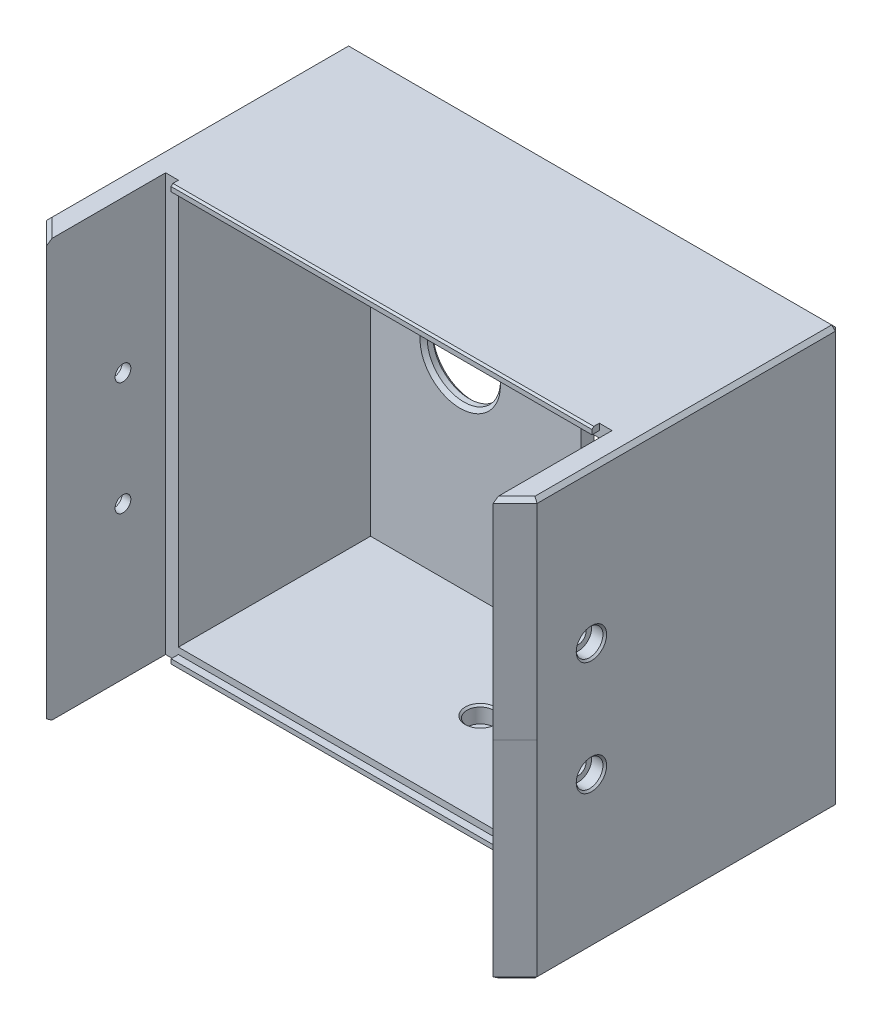
from build123d import *

# Parameters (mm, degrees)
SKETCH1_W                       = 134
SKETCH1_H                       = 57
BOSS_EXTRUDE1_DEPTH             = 250
SKETCH2_W                       = 115
SKETCH2_H                       = 53.5
CUT_EXTRUDE1_DEPTH              = 246.5
SKETCH3_W                       = 115
SKETCH3_H                       = 194
CUT_EXTRUDE2_DEPTH              = 3.5
SKETCH4_W                       = 6
SKETCH4_H                       = 120
CUT_EXTRUDE3_DEPTH              = 290.318163965
CHAMFER1_SIZE                   = 6
SKETCH5_R                       = 2.15
CUT_EXTRUDE4_DEPTH              = 134
SKETCH6_W                       = 25
SKETCH6_H                       = 4.5
BOSS_EXTRUDE2_DEPTH             = 115
SKETCH7_R                       = 3.65
CUT_EXTRUDE5_DEPTH              = 3.6
CUT_EXTRUDE6_START              = -3.6
SKETCH8_R                       = 3.65
CUT_EXTRUDE6_DEPTH              = 3.6
CHAMFER1_OF_MIRROR1_SIZE        = 6
SKETCH9_R                       = 1.65
CUT_EXTRUDE7_DEPTH              = 25
CHAMFER3_SIZE                   = 0.5
SKETCH11_R                      = 1.65
CUT_EXTRUDE9_DEPTH              = 3.5
CUT_EXTRUDE10_DEPTH             = 306.69919856
BOSS_EXTRUDE4_DEPTH             = 10
CHAMFER4_SIZE                   = 10
BOSS_EXTRUDE5_REACH             = 159.166
BOSS_EXTRUDE5_DIRECTION_2_DEPTH = 3.5
SKETCH17_R                      = 10
CUT_EXTRUDE13_DEPTH             = 3.5
SKETCH15_R                      = 2.15
CUT_EXTRUDE11_DEPTH             = 13.5
SKETCH16_R                      = 3.65
CUT_EXTRUDE12_DEPTH             = 4.5
CHAMFER6_SIZE                   = 1
CHAMFER5_SIZE                   = 0.5
SKETCH19_W                      = 33
SKETCH19_H                      = 3.5
CUT_EXTRUDE14_DEPTH             = 3.5
CHAMFER8_SIZE                   = 3.5
SKETCH20_W                      = 122
SKETCH20_H                      = 1.75
BOSS_EXTRUDE6_DEPTH             = 2
SKETCH21_W                      = 3.5
SKETCH21_H                      = 2
CUT_EXTRUDE15_DEPTH             = 114
CHAMFER9_SIZE                   = 0.5


# Some blends are built 0.0001 mm under size
with BuildPart() as part:
    # Sketch1 → Boss-Extrude1 (new body)
    with BuildSketch(Plane.XY):
        with Locations((67, 28.5)):
            Rectangle(SKETCH1_W, SKETCH1_H)
    boss_extrude1 = extrude(amount=BOSS_EXTRUDE1_DEPTH)

    # Sketch2 → Cut-Extrude1 (cut)
    with BuildSketch(Plane.XY.offset(250)):
        with Locations((67, 26.75)):
            Rectangle(SKETCH2_W, SKETCH2_H)
    cut_extrude1 = extrude(amount=-CUT_EXTRUDE1_DEPTH, mode=Mode.SUBTRACT)

    # Sketch3 → Cut-Extrude2 (cut)
    with BuildSketch(Plane(origin=(0, 57, 0), x_dir=(1, 0, 0), z_dir=(0, 1, 0))):
        with Locations((67, -153)):
            Rectangle(SKETCH3_W, SKETCH3_H)
    cut_extrude2 = extrude(amount=-CUT_EXTRUDE2_DEPTH, mode=Mode.SUBTRACT)

    # Sketch4 → Cut-Extrude3 (cut, through all)
    with BuildSketch(Plane.XZ):
        with Locations((3, 142.5)):
            Rectangle(SKETCH4_W, SKETCH4_H)
        with Locations((131, 142.5)):
            Rectangle(SKETCH4_W, SKETCH4_H)
    cut_extrude3 = extrude(amount=-CUT_EXTRUDE3_DEPTH, mode=Mode.SUBTRACT)

    # Chamfer1
    chamfer1_edges = [part.edges().sort_by_distance(p)[0] for p in [
        (6, 28.5, 202.5),
        (6, 28.5, 82.5),
        (128, 28.5, 82.5),
        (128, 28.5, 202.5),
    ]]
    chamfer(chamfer1_edges, length=CHAMFER1_SIZE - 0.0001)  # a hair under: the kernel refuses the full size

    # Sketch5 → Cut-Extrude4 (cut)
    with BuildSketch(Plane(origin=(134, 0, 0), x_dir=(0, 0, -1), z_dir=(1, 0, 0))):
        with Locations((-217.65, 15.5)):
            Circle(SKETCH5_R)
        with Locations((-67.65, 15.5)):
            Circle(SKETCH5_R)
    cut_extrude4 = extrude(amount=-CUT_EXTRUDE4_DEPTH, mode=Mode.SUBTRACT)

    # Sketch6 → Boss-Extrude2 (add)
    with BuildSketch(Plane(origin=(9.5, 0, 0), x_dir=(0, 0, -1), z_dir=(1, 0, 0))):
        with Locations((-237.5, 2.25)):
            Rectangle(SKETCH6_W, SKETCH6_H)
    boss_extrude2 = extrude(amount=BOSS_EXTRUDE2_DEPTH)

    # Sketch7 → Cut-Extrude5 (cut)
    with BuildSketch(Plane(origin=(134, 0, 0), x_dir=(0, 0, -1), z_dir=(1, 0, 0))):
        with Locations((-217.65, 15.5)):
            Circle(SKETCH7_R)
        with Locations((-67.65, 15.5)):
            Circle(SKETCH7_R)
    cut_extrude5 = extrude(amount=-CUT_EXTRUDE5_DEPTH, mode=Mode.SUBTRACT)

    # Sketch8 → Cut-Extrude6 (cut)
    with BuildSketch(Plane.ZY.offset(CUT_EXTRUDE6_START)):
        with Locations(Location((217.65, 15.5, 0), (0, 0, 180))):
            Circle(SKETCH8_R)
        with Locations(Location((67.65, 15.5, 0), (0, 0, 180))):
            Circle(SKETCH8_R)
    cut_extrude6 = extrude(amount=CUT_EXTRUDE6_DEPTH, mode=Mode.SUBTRACT)


with BuildPart() as mirror1_1:
    # Mirror1: Boss-Extrude1 across plane
    add(boss_extrude1.mirror(Plane.ZX))

    # Mirror1 2: Cut-Extrude1, Cut-Extrude2, Cut-Extrude3, Cut-Extrude4 across plane
    add(cut_extrude1.mirror(Plane.ZX), mode=Mode.SUBTRACT)
    add(cut_extrude2.mirror(Plane.ZX), mode=Mode.SUBTRACT)
    add(cut_extrude3.mirror(Plane.ZX), mode=Mode.SUBTRACT)
    add(cut_extrude4.mirror(Plane.ZX), mode=Mode.SUBTRACT)

    # Mirror1 4: Cut-Extrude5, Cut-Extrude6 across plane
    add(cut_extrude5.mirror(Plane.ZX), mode=Mode.SUBTRACT)
    add(cut_extrude6.mirror(Plane.ZX), mode=Mode.SUBTRACT)

    # Chamfer1 of Mirror1
    chamfer1_of_mirror1_edges = [mirror1_1.edges().sort_by_distance(p)[0] for p in [
        (6, -28.5, 202.5),
        (6, -28.5, 82.5),
        (128, -28.5, 82.5),
        (128, -28.5, 202.5),
    ]]
    chamfer(chamfer1_of_mirror1_edges, length=CHAMFER1_OF_MIRROR1_SIZE - 0.0001)  # a hair under: the kernel refuses the full size


with BuildPart() as mirror1_3_1:
    # Mirror1 3: Boss-Extrude2 across plane
    add(boss_extrude2.mirror(Plane.ZX))


with BuildPart() as part_1:
    add(part.part)

    # Mirror1 united with what the copies touc: union Mirror1_1, Mirror1 3_1
    add(mirror1_1.part)
    add(mirror1_3_1.part)

    # Sketch9 → Cut-Extrude7 (cut)
    with BuildSketch(Plane.XY.offset(250)):
        with Locations((25, 0)):
            Circle(SKETCH9_R)
        with Locations((109, 0)):
            Circle(SKETCH9_R)
    extrude(amount=-CUT_EXTRUDE7_DEPTH, mode=Mode.SUBTRACT)

    # Chamfer2
    # the kernel refuses this chamfer: 1 mm, written as the material it takes off along each edge
    with BuildSketch(Plane(origin=(133.333333333, -56.333333333, 0.666666667), x_dir=(-0.7071067811865475, -0.7071067811865475, 0), z_dir=(0.5773502691896257, -0.5773502691896258, -0.5773502691896258))) as chamfer2_piece_1:
        Polygon((-0.707106781, -0.40824829), (0.707106781, -0.40824829), (0, 0.816496581), align=None)
    extrude(amount=1.270170592, mode=Mode.SUBTRACT)
    with BuildSketch(Plane(origin=(0.666666667, -56.333333333, 0.666666667), x_dir=(0.7071067811865475, -0.7071067811865475, 0), z_dir=(-0.5773502691896258, -0.5773502691896258, -0.5773502691896258)), Plane(origin=(133.333333333, 56.333333333, 0.666666667), x_dir=(-0.7071067811865475, 0.7071067811865475, 0), z_dir=(0.5773502691896257, 0.5773502691896258, -0.5773502691896258)), Plane(origin=(0.666666667, 56.333333333, 0.666666667), x_dir=(-0.7071067811865475, -0.7071067811865475, 0), z_dir=(-0.5773502691896257, 0.5773502691896258, -0.5773502691896257))) as chamfer2_piece_2:
        Polygon((-0.707106781, 0.40824829), (0.707106781, 0.40824829), (0, -0.816496581), align=None)
    extrude(amount=1.270170592, mode=Mode.SUBTRACT)
    with BuildSketch(Plane(origin=(0, -57, 199.928317012), x_dir=(0.9996219169112968, -0.02749587661058908, 0), z_dir=(0, 0, 1)), Plane(origin=(134, 57, 199.928317012), x_dir=(-0.9996219169112968, 0.027495876610589196, 0), z_dir=(0, 0, 1))) as chamfer2_piece_3:
        with BuildLine():
            Line((1.028673195, 0), (-0.056547155, 1.027117794))
            Line((-0.056547155, 1.027117794), (-0.076539593, 1.026567876))
            ThreePointArc((-0.076539593, 1.026567876), (-0.034129227, 0.51339783), (-0.019992438, -0.000549918))
            Line((-0.019992438, -0.000549918), (0.000549918, -0.019992438))
            ThreePointArc((0.000549918, -0.019992438), (0.514497665, -0.00585565), (1.029223113, -0.019992438))
            Line((1.029223113, -0.019992438), (1.028673195, 0))
        make_face()
    extrude(amount=52.643365976, mode=Mode.SUBTRACT)
    with BuildSketch(Plane(origin=(134, -57, 199.928317012), x_dir=(-0.9996219169112968, -0.027495876610589196, 0), z_dir=(0, 0, 1)), Plane(origin=(0, 57, 199.928317012), x_dir=(0.9996219169112968, 0.02749587661058908, 0), z_dir=(0, 0, 1))) as chamfer2_piece_4:
        with BuildLine():
            Line((1.028673195, 0), (-0.056547155, -1.027117794))
            Line((-0.056547155, -1.027117794), (-0.076539593, -1.026567876))
            ThreePointArc((-0.076539593, -1.026567876), (-0.034129227, -0.51339783), (-0.019992438, 0.000549918))
            Line((-0.019992438, 0.000549918), (0.000549918, 0.019992438))
            ThreePointArc((0.000549918, 0.019992438), (0.514497665, 0.00585565), (1.029223113, 0.019992438))
            Line((1.029223113, 0.019992438), (1.028673195, 0))
        make_face()
    extrude(amount=52.643365976, mode=Mode.SUBTRACT)
    with BuildSketch(Plane(origin=(136.571682988, -57, 0), x_dir=(0, -0.02749587661058908, 0.9996219169112968), z_dir=(-1, 0, 0))) as chamfer2_piece_5:
        with BuildLine():
            Line((1.028673195, 0), (-0.056547155, 1.027117794))
            Line((-0.056547155, 1.027117794), (-0.076539593, 1.026567876))
            ThreePointArc((-0.076539593, 1.026567876), (-0.034129227, 0.51339783), (-0.019992438, -0.000549918))
            Line((-0.019992438, -0.000549918), (0.000549918, -0.019992438))
            ThreePointArc((0.000549918, -0.019992438), (0.514497665, -0.00585565), (1.029223113, -0.019992438))
            Line((1.029223113, -0.019992438), (1.028673195, 0))
        make_face()
    extrude(amount=139.143365976, mode=Mode.SUBTRACT)
    with BuildSketch(Plane(origin=(134, -57, -2.571682988), x_dir=(0.027495876610582105, 0.999621916911297, 0), z_dir=(0, 0, 1)), Plane(origin=(0, -57, -2.571682988), x_dir=(0.9996219169112968, -0.02749587661058908, 0), z_dir=(0, 0, 1))) as chamfer2_piece_6:
        with BuildLine():
            Line((1.028673195, 0), (-0.056547155, 1.027117794))
            Line((-0.056547155, 1.027117794), (-0.076539593, 1.026567876))
            ThreePointArc((-0.076539593, 1.026567876), (-0.034129227, 0.51339783), (-0.019992438, -0.000549918))
            Line((-0.019992438, -0.000549918), (0.000549918, -0.019992438))
            ThreePointArc((0.000549918, -0.019992438), (0.514497665, -0.00585565), (1.029223113, -0.019992438))
            Line((1.029223113, -0.019992438), (1.028673195, 0))
        make_face()
    extrude(amount=87.643365976, mode=Mode.SUBTRACT)
    with BuildSketch(Plane(origin=(6, -57, 85.928217012), x_dir=(0.9996219169112968, -0.027495876610589075, 0), z_dir=(0, 0, 1))) as chamfer2_piece_7_section:
        with BuildLine():
            Line((1.028673195, 0), (-0.056547155, 1.027117794))
            Line((-0.056547155, 1.027117794), (-0.076539593, 1.026567876))
            ThreePointArc((-0.076539593, 1.026567876), (-0.034129227, 0.51339783), (-0.019992438, -0.000549918))
            Line((-0.019992438, -0.000549918), (0.000549918, -0.019992438))
            ThreePointArc((0.000549918, -0.019992438), (0.514497665, -0.00585565), (1.029223113, -0.019992438))
            Line((1.029223113, -0.019992438), (1.028673195, 0))
        make_face()
    chamfer2_piece_7 = extrude(amount=113.143565976, mode=Mode.PRIVATE)
    chamfer2_piece_7 = split(chamfer2_piece_7, bisect_by=Plane(origin=(33.164355215, -56.669573831, 115.664255215), z_dir=(-0.7071067811865475, 0, 0.7071067811865477)), keep=Keep.TOP, mode=Mode.PRIVATE)
    chamfer2_piece_7 = split(chamfer2_piece_7, bisect_by=Plane(origin=(33.164355215, -56.669573831, 169.335744785), z_dir=(-0.7071067811865472, 0, -0.7071067811865478)), keep=Keep.TOP, mode=Mode.PRIVATE)
    add(chamfer2_piece_7, mode=Mode.SUBTRACT)
    with BuildSketch(Plane(origin=(128, -57, 85.928217012), x_dir=(0.027495876610582105, 0.999621916911297, 0), z_dir=(0, 0, 1))) as chamfer2_piece_8_section:
        with BuildLine():
            Line((1.028673195, 0), (-0.056547155, 1.027117794))
            Line((-0.056547155, 1.027117794), (-0.076539593, 1.026567876))
            ThreePointArc((-0.076539593, 1.026567876), (-0.034129227, 0.51339783), (-0.019992438, -0.000549918))
            Line((-0.019992438, -0.000549918), (0.000549918, -0.019992438))
            ThreePointArc((0.000549918, -0.019992438), (0.514497665, -0.00585565), (1.029223113, -0.019992438))
            Line((1.029223113, -0.019992438), (1.028673195, 0))
        make_face()
    chamfer2_piece_8 = extrude(amount=113.143565976, mode=Mode.PRIVATE)
    chamfer2_piece_8 = split(chamfer2_piece_8, bisect_by=Plane(origin=(100.835644785, -56.669573831, 115.664255215), z_dir=(0.7071067811865476, 0, 0.7071067811865476)), keep=Keep.TOP, mode=Mode.PRIVATE)
    chamfer2_piece_8 = split(chamfer2_piece_8, bisect_by=Plane(origin=(100.835644785, -56.669573831, 169.335744785), z_dir=(0.7071067811865476, 0, -0.7071067811865476)), keep=Keep.TOP, mode=Mode.PRIVATE)
    add(chamfer2_piece_8, mode=Mode.SUBTRACT)
    with BuildSketch(Plane(origin=(-1.81835448, -57, 204.31845448), x_dir=(0.7068394360706731, -0.027495876610588672, 0.7068394360706738), z_dir=(0.7071067811865479, 0, -0.7071067811865474))) as chamfer2_piece_9_section:
        with BuildLine():
            Line((1.028673195, 0), (-0.056547155, -1.027117794))
            Line((-0.056547155, -1.027117794), (-0.076539593, -1.026567876))
            ThreePointArc((-0.076539593, -1.026567876), (-0.034129227, -0.51339783), (-0.019992438, 0.000549918))
            Line((-0.019992438, 0.000549918), (0.000549918, 0.019992438))
            ThreePointArc((0.000549918, 0.019992438), (0.514497665, 0.00585565), (1.029223113, 0.019992438))
            Line((1.029223113, 0.019992438), (1.028673195, 0))
        make_face()
    chamfer2_piece_9 = extrude(amount=13.628505929, mode=Mode.PRIVATE)
    chamfer2_piece_9 = split(chamfer2_piece_9, bisect_by=Plane(origin=(6, -56.681906875, 203.533564865), z_dir=(-1, 0, 0)), keep=Keep.TOP, mode=Mode.PRIVATE)
    add(chamfer2_piece_9, mode=Mode.SUBTRACT)
    with BuildSketch(Plane(origin=(7.81845448, -57, 90.31835448), x_dir=(0.7068394360706733, -0.027495876610588946, -0.7068394360706736), z_dir=(-0.7071067811865477, 0, -0.7071067811865475))) as chamfer2_piece_10_section:
        with BuildLine():
            Line((1.028673195, 0), (-0.056547155, -1.027117794))
            Line((-0.056547155, -1.027117794), (-0.076539593, -1.026567876))
            ThreePointArc((-0.076539593, -1.026567876), (-0.034129227, -0.51339783), (-0.019992438, 0.000549918))
            Line((-0.019992438, 0.000549918), (0.000549918, 0.019992438))
            ThreePointArc((0.000549918, 0.019992438), (0.514497665, 0.00585565), (1.029223113, 0.019992438))
            Line((1.029223113, 0.019992438), (1.028673195, 0))
        make_face()
    chamfer2_piece_10 = extrude(amount=13.628505929, mode=Mode.PRIVATE)
    chamfer2_piece_10 = split(chamfer2_piece_10, bisect_by=Plane(origin=(6, -56.661529994, 85.278226705), z_dir=(-1, 0, 0)), keep=Keep.TOP, mode=Mode.PRIVATE)
    add(chamfer2_piece_10, mode=Mode.SUBTRACT)
    with BuildSketch(Plane(origin=(135.81835448, -57, 80.68154552), x_dir=(0.01944252080601719, 0.9996219169112965, 0.01944252080601719), z_dir=(-0.7071067811865476, 0, 0.7071067811865476))) as chamfer2_piece_11_section:
        with BuildLine():
            Line((1.028673195, 0), (-0.056547155, 1.027117794))
            Line((-0.056547155, 1.027117794), (-0.076539593, 1.026567876))
            ThreePointArc((-0.076539593, 1.026567876), (-0.034129227, 0.51339783), (-0.019992438, -0.000549918))
            Line((-0.019992438, -0.000549918), (0.000549918, -0.019992438))
            ThreePointArc((0.000549918, -0.019992438), (0.514497665, -0.00585565), (1.029223113, -0.019992438))
            Line((1.029223113, -0.019992438), (1.028673195, 0))
        make_face()
    chamfer2_piece_11 = extrude(amount=13.628505929, mode=Mode.PRIVATE)
    chamfer2_piece_11 = split(chamfer2_piece_11, bisect_by=Plane(origin=(128, -56.681906875, 81.466435135), z_dir=(1, 0, 0)), keep=Keep.TOP, mode=Mode.PRIVATE)
    add(chamfer2_piece_11, mode=Mode.SUBTRACT)
    with BuildSketch(Plane(origin=(126.18154552, -57, 194.68164552), x_dir=(-0.7068394360706735, -0.027495876610588745, 0.7068394360706735), z_dir=(0.7071067811865476, 0, 0.7071067811865476))) as chamfer2_piece_12_section:
        with BuildLine():
            Line((1.028673195, 0), (-0.056547155, -1.027117794))
            Line((-0.056547155, -1.027117794), (-0.076539593, -1.026567876))
            ThreePointArc((-0.076539593, -1.026567876), (-0.034129227, -0.51339783), (-0.019992438, 0.000549918))
            Line((-0.019992438, 0.000549918), (0.000549918, 0.019992438))
            ThreePointArc((0.000549918, 0.019992438), (0.514497665, 0.00585565), (1.029223113, 0.019992438))
            Line((1.029223113, 0.019992438), (1.028673195, 0))
        make_face()
    chamfer2_piece_12 = extrude(amount=13.628505929, mode=Mode.PRIVATE)
    chamfer2_piece_12 = split(chamfer2_piece_12, bisect_by=Plane(origin=(128, -56.661529994, 199.721773295), z_dir=(1, 0, 0)), keep=Keep.TOP, mode=Mode.PRIVATE)
    add(chamfer2_piece_12, mode=Mode.SUBTRACT)
    with BuildSketch(Plane(origin=(134, 57, -2.571682988), x_dir=(0.027495876610582105, -0.999621916911297, 0), z_dir=(0, 0, 1)), Plane(origin=(0, 57, -2.571682988), x_dir=(0.9996219169112968, 0.02749587661058908, 0), z_dir=(0, 0, 1))) as chamfer2_piece_13:
        with BuildLine():
            Line((1.028673195, 0), (-0.056547155, -1.027117794))
            Line((-0.056547155, -1.027117794), (-0.076539593, -1.026567876))
            ThreePointArc((-0.076539593, -1.026567876), (-0.034129227, -0.51339783), (-0.019992438, 0.000549918))
            Line((-0.019992438, 0.000549918), (0.000549918, 0.019992438))
            ThreePointArc((0.000549918, 0.019992438), (0.514497665, 0.00585565), (1.029223113, 0.019992438))
            Line((1.029223113, 0.019992438), (1.028673195, 0))
        make_face()
    extrude(amount=87.643365976, mode=Mode.SUBTRACT)
    with BuildSketch(Plane(origin=(136.571682988, 57, 0), x_dir=(0, 0.02749587661058908, 0.9996219169112968), z_dir=(-1, 0, 0))) as chamfer2_piece_14:
        with BuildLine():
            Line((1.028673195, 0), (-0.056547155, -1.027117794))
            Line((-0.056547155, -1.027117794), (-0.076539593, -1.026567876))
            ThreePointArc((-0.076539593, -1.026567876), (-0.034129227, -0.51339783), (-0.019992438, 0.000549918))
            Line((-0.019992438, 0.000549918), (0.000549918, 0.019992438))
            ThreePointArc((0.000549918, 0.019992438), (0.514497665, 0.00585565), (1.029223113, 0.019992438))
            Line((1.029223113, 0.019992438), (1.028673195, 0))
        make_face()
    extrude(amount=139.143365976, mode=Mode.SUBTRACT)
    with BuildSketch(Plane(origin=(134, -59.571682988, 0), x_dir=(0.027495876610582174, 0, 0.9996219169112968), z_dir=(0, 1, 0)), Plane(origin=(0, -59.571682988, 0), x_dir=(0.9996219169112968, 0, -0.027495876610586372), z_dir=(0, 1, 0))) as chamfer2_piece_15:
        with BuildLine():
            Line((1.028673195, 0), (-0.056547155, -1.027117794))
            Line((-0.056547155, -1.027117794), (-0.076539593, -1.026567876))
            ThreePointArc((-0.076539593, -1.026567876), (-0.034129227, -0.51339783), (-0.019992438, 0.000549918))
            Line((-0.019992438, 0.000549918), (0.000549918, 0.019992438))
            ThreePointArc((0.000549918, 0.019992438), (0.514497665, 0.00585565), (1.029223113, 0.019992438))
            Line((1.029223113, 0.019992438), (1.028673195, 0))
        make_face()
    extrude(amount=119.143365976, mode=Mode.SUBTRACT)
    with BuildSketch(Plane(origin=(6, 57, 199.071782988), x_dir=(0.9996219169112968, 0.027495876610589075, 0), z_dir=(0, 0, -1))) as chamfer2_piece_16_section:
        with BuildLine():
            Line((1.028673195, 0), (-0.056547155, 1.027117794))
            Line((-0.056547155, 1.027117794), (-0.076539593, 1.026567876))
            ThreePointArc((-0.076539593, 1.026567876), (-0.034129227, 0.51339783), (-0.019992438, -0.000549918))
            Line((-0.019992438, -0.000549918), (0.000549918, -0.019992438))
            ThreePointArc((0.000549918, -0.019992438), (0.514497665, -0.00585565), (1.029223113, -0.019992438))
            Line((1.029223113, -0.019992438), (1.028673195, 0))
        make_face()
    chamfer2_piece_16 = extrude(amount=113.143565976, mode=Mode.PRIVATE)
    chamfer2_piece_16 = split(chamfer2_piece_16, bisect_by=Plane(origin=(33.164355215, 56.669573831, 115.664255215), z_dir=(-0.7071067811865475, 0, 0.7071067811865477)), keep=Keep.TOP, mode=Mode.PRIVATE)
    chamfer2_piece_16 = split(chamfer2_piece_16, bisect_by=Plane(origin=(33.164355215, 56.669573831, 169.335744785), z_dir=(-0.7071067811865472, 0, -0.7071067811865478)), keep=Keep.TOP, mode=Mode.PRIVATE)
    add(chamfer2_piece_16, mode=Mode.SUBTRACT)
    with BuildSketch(Plane(origin=(128, 57, 199.071782988), x_dir=(-0.9996219169112968, 0.027495876610589196, 0), z_dir=(0, 0, -1))) as chamfer2_piece_17_section:
        with BuildLine():
            Line((1.028673195, 0), (-0.056547155, -1.027117794))
            Line((-0.056547155, -1.027117794), (-0.076539593, -1.026567876))
            ThreePointArc((-0.076539593, -1.026567876), (-0.034129227, -0.51339783), (-0.019992438, 0.000549918))
            Line((-0.019992438, 0.000549918), (0.000549918, 0.019992438))
            ThreePointArc((0.000549918, 0.019992438), (0.514497665, 0.00585565), (1.029223113, 0.019992438))
            Line((1.029223113, 0.019992438), (1.028673195, 0))
        make_face()
    chamfer2_piece_17 = extrude(amount=113.143565976, mode=Mode.PRIVATE)
    chamfer2_piece_17 = split(chamfer2_piece_17, bisect_by=Plane(origin=(100.835644785, 56.669573831, 115.664255215), z_dir=(0.7071067811865476, 0, 0.7071067811865476)), keep=Keep.TOP, mode=Mode.PRIVATE)
    chamfer2_piece_17 = split(chamfer2_piece_17, bisect_by=Plane(origin=(100.835644785, 56.669573831, 169.335744785), z_dir=(0.7071067811865476, 0, -0.7071067811865476)), keep=Keep.TOP, mode=Mode.PRIVATE)
    add(chamfer2_piece_17, mode=Mode.SUBTRACT)
    with BuildSketch(Plane(origin=(-1.81835448, 57, 204.31845448), x_dir=(0.7068394360706731, 0.027495876610588672, 0.7068394360706738), z_dir=(0.7071067811865479, 0, -0.7071067811865474))) as chamfer2_piece_18_section:
        with BuildLine():
            Line((1.028673195, 0), (-0.056547155, 1.027117794))
            Line((-0.056547155, 1.027117794), (-0.076539593, 1.026567876))
            ThreePointArc((-0.076539593, 1.026567876), (-0.034129227, 0.51339783), (-0.019992438, -0.000549918))
            Line((-0.019992438, -0.000549918), (0.000549918, -0.019992438))
            ThreePointArc((0.000549918, -0.019992438), (0.514497665, -0.00585565), (1.029223113, -0.019992438))
            Line((1.029223113, -0.019992438), (1.028673195, 0))
        make_face()
    chamfer2_piece_18 = extrude(amount=13.628505929, mode=Mode.PRIVATE)
    chamfer2_piece_18 = split(chamfer2_piece_18, bisect_by=Plane(origin=(6, 56.681906875, 203.533564865), z_dir=(-1, 0, 0)), keep=Keep.TOP, mode=Mode.PRIVATE)
    add(chamfer2_piece_18, mode=Mode.SUBTRACT)
    with BuildSketch(Plane(origin=(7.81845448, 57, 90.31835448), x_dir=(0.7068394360706733, 0.027495876610588946, -0.7068394360706736), z_dir=(-0.7071067811865477, 0, -0.7071067811865475))) as chamfer2_piece_19_section:
        with BuildLine():
            Line((1.028673195, 0), (-0.056547155, 1.027117794))
            Line((-0.056547155, 1.027117794), (-0.076539593, 1.026567876))
            ThreePointArc((-0.076539593, 1.026567876), (-0.034129227, 0.51339783), (-0.019992438, -0.000549918))
            Line((-0.019992438, -0.000549918), (0.000549918, -0.019992438))
            ThreePointArc((0.000549918, -0.019992438), (0.514497665, -0.00585565), (1.029223113, -0.019992438))
            Line((1.029223113, -0.019992438), (1.028673195, 0))
        make_face()
    chamfer2_piece_19 = extrude(amount=13.628505929, mode=Mode.PRIVATE)
    chamfer2_piece_19 = split(chamfer2_piece_19, bisect_by=Plane(origin=(6, 56.661529994, 85.278226705), z_dir=(-1, 0, 0)), keep=Keep.TOP, mode=Mode.PRIVATE)
    add(chamfer2_piece_19, mode=Mode.SUBTRACT)
    with BuildSketch(Plane(origin=(135.81835448, 57, 80.68154552), x_dir=(0.01944252080601719, -0.9996219169112965, 0.01944252080601719), z_dir=(-0.7071067811865476, 0, 0.7071067811865476))) as chamfer2_piece_20_section:
        with BuildLine():
            Line((1.028673195, 0), (-0.056547155, -1.027117794))
            Line((-0.056547155, -1.027117794), (-0.076539593, -1.026567876))
            ThreePointArc((-0.076539593, -1.026567876), (-0.034129227, -0.51339783), (-0.019992438, 0.000549918))
            Line((-0.019992438, 0.000549918), (0.000549918, 0.019992438))
            ThreePointArc((0.000549918, 0.019992438), (0.514497665, 0.00585565), (1.029223113, 0.019992438))
            Line((1.029223113, 0.019992438), (1.028673195, 0))
        make_face()
    chamfer2_piece_20 = extrude(amount=13.628505929, mode=Mode.PRIVATE)
    chamfer2_piece_20 = split(chamfer2_piece_20, bisect_by=Plane(origin=(128, 56.681906875, 81.466435135), z_dir=(1, 0, 0)), keep=Keep.TOP, mode=Mode.PRIVATE)
    add(chamfer2_piece_20, mode=Mode.SUBTRACT)
    with BuildSketch(Plane(origin=(126.18154552, 57, 194.68164552), x_dir=(-0.7068394360706735, 0.027495876610588745, 0.7068394360706735), z_dir=(0.7071067811865476, 0, 0.7071067811865476))) as chamfer2_piece_21_section:
        with BuildLine():
            Line((1.028673195, 0), (-0.056547155, 1.027117794))
            Line((-0.056547155, 1.027117794), (-0.076539593, 1.026567876))
            ThreePointArc((-0.076539593, 1.026567876), (-0.034129227, 0.51339783), (-0.019992438, -0.000549918))
            Line((-0.019992438, -0.000549918), (0.000549918, -0.019992438))
            ThreePointArc((0.000549918, -0.019992438), (0.514497665, -0.00585565), (1.029223113, -0.019992438))
            Line((1.029223113, -0.019992438), (1.028673195, 0))
        make_face()
    chamfer2_piece_21 = extrude(amount=13.628505929, mode=Mode.PRIVATE)
    chamfer2_piece_21 = split(chamfer2_piece_21, bisect_by=Plane(origin=(128, 56.661529994, 199.721773295), z_dir=(1, 0, 0)), keep=Keep.TOP, mode=Mode.PRIVATE)
    add(chamfer2_piece_21, mode=Mode.SUBTRACT)
    with BuildSketch(Plane(origin=(7.81845448, -57, 90.31835448), x_dir=(0.7068394360706733, -0.027495876610588946, -0.7068394360706736), z_dir=(-0.7071067811865477, 0, -0.7071067811865475))) as chamfer2_piece_22a_section:
        with BuildLine():
            Line((1.028673195, 0), (-0.056547155, -1.027117794))
            Line((-0.056547155, -1.027117794), (-0.076539593, -1.026567876))
            ThreePointArc((-0.076539593, -1.026567876), (-0.034129227, -0.51339783), (-0.019992438, 0.000549918))
            Line((-0.019992438, 0.000549918), (0.000549918, 0.019992438))
            ThreePointArc((0.000549918, 0.019992438), (0.514497665, 0.00585565), (1.029223113, 0.019992438))
            Line((1.029223113, 0.019992438), (1.028673195, 0))
        make_face()
    chamfer2_piece_22a = extrude(amount=13.628505929, mode=Mode.PRIVATE)
    chamfer2_piece_22a = split(chamfer2_piece_22a, bisect_by=Plane(origin=(6, -56.681906875, 89.036114365), z_dir=(1, 0, 0)), keep=Keep.TOP, mode=Mode.PRIVATE)
    with BuildSketch(Plane(origin=(6, -57, 85.928217012), x_dir=(0.9996219169112968, -0.027495876610589075, 0), z_dir=(0, 0, 1))) as chamfer2_piece_22b_section:
        with BuildLine():
            Line((1.028673195, 0), (-0.056547155, 1.027117794))
            Line((-0.056547155, 1.027117794), (-0.076539593, 1.026567876))
            ThreePointArc((-0.076539593, 1.026567876), (-0.034129227, 0.51339783), (-0.019992438, -0.000549918))
            Line((-0.019992438, -0.000549918), (0.000549918, -0.019992438))
            ThreePointArc((0.000549918, -0.019992438), (0.514497665, -0.00585565), (1.029223113, -0.019992438))
            Line((1.029223113, -0.019992438), (1.028673195, 0))
        make_face()
    chamfer2_piece_22b = extrude(amount=113.143565976, mode=Mode.PRIVATE)
    chamfer2_piece_22b = split(chamfer2_piece_22b, bisect_by=Plane(origin=(5.620839187, -56.681906875, 88.120739187), z_dir=(0.7071067811865475, 0, -0.7071067811865477)), keep=Keep.TOP, mode=Mode.PRIVATE)
    chamfer2_piece_22 = chamfer2_piece_22a & chamfer2_piece_22b
    add(chamfer2_piece_22, mode=Mode.SUBTRACT)
    with BuildSketch(Plane(origin=(6, -57, 85.928217012), x_dir=(0.9996219169112968, -0.027495876610589075, 0), z_dir=(0, 0, 1))) as chamfer2_piece_23a_section:
        with BuildLine():
            Line((1.028673195, 0), (-0.056547155, 1.027117794))
            Line((-0.056547155, 1.027117794), (-0.076539593, 1.026567876))
            ThreePointArc((-0.076539593, 1.026567876), (-0.034129227, 0.51339783), (-0.019992438, -0.000549918))
            Line((-0.019992438, -0.000549918), (0.000549918, -0.019992438))
            ThreePointArc((0.000549918, -0.019992438), (0.514497665, -0.00585565), (1.029223113, -0.019992438))
            Line((1.029223113, -0.019992438), (1.028673195, 0))
        make_face()
    chamfer2_piece_23a = extrude(amount=113.143565976, mode=Mode.PRIVATE)
    chamfer2_piece_23a = split(chamfer2_piece_23a, bisect_by=Plane(origin=(5.620839187, -56.681906875, 196.879260813), z_dir=(0.7071067811865472, 0, 0.7071067811865478)), keep=Keep.TOP, mode=Mode.PRIVATE)
    with BuildSketch(Plane(origin=(-1.81835448, -57, 204.31845448), x_dir=(0.7068394360706731, -0.027495876610588672, 0.7068394360706738), z_dir=(0.7071067811865479, 0, -0.7071067811865474))) as chamfer2_piece_23b_section:
        with BuildLine():
            Line((1.028673195, 0), (-0.056547155, -1.027117794))
            Line((-0.056547155, -1.027117794), (-0.076539593, -1.026567876))
            ThreePointArc((-0.076539593, -1.026567876), (-0.034129227, -0.51339783), (-0.019992438, 0.000549918))
            Line((-0.019992438, 0.000549918), (0.000549918, 0.019992438))
            ThreePointArc((0.000549918, 0.019992438), (0.514497665, 0.00585565), (1.029223113, 0.019992438))
            Line((1.029223113, 0.019992438), (1.028673195, 0))
        make_face()
    chamfer2_piece_23b = extrude(amount=13.628505929, mode=Mode.PRIVATE)
    chamfer2_piece_23b = split(chamfer2_piece_23b, bisect_by=Plane(origin=(6, -56.681906875, 195.963885635), z_dir=(1, 0, 0)), keep=Keep.TOP, mode=Mode.PRIVATE)
    chamfer2_piece_23 = chamfer2_piece_23a & chamfer2_piece_23b
    add(chamfer2_piece_23, mode=Mode.SUBTRACT)
    with BuildSketch(Plane(origin=(135.81835448, -57, 80.68154552), x_dir=(0.01944252080601719, 0.9996219169112965, 0.01944252080601719), z_dir=(-0.7071067811865476, 0, 0.7071067811865476))) as chamfer2_piece_24a_section:
        with BuildLine():
            Line((1.028673195, 0), (-0.056547155, 1.027117794))
            Line((-0.056547155, 1.027117794), (-0.076539593, 1.026567876))
            ThreePointArc((-0.076539593, 1.026567876), (-0.034129227, 0.51339783), (-0.019992438, -0.000549918))
            Line((-0.019992438, -0.000549918), (0.000549918, -0.019992438))
            ThreePointArc((0.000549918, -0.019992438), (0.514497665, -0.00585565), (1.029223113, -0.019992438))
            Line((1.029223113, -0.019992438), (1.028673195, 0))
        make_face()
    chamfer2_piece_24a = extrude(amount=13.628505929, mode=Mode.PRIVATE)
    chamfer2_piece_24a = split(chamfer2_piece_24a, bisect_by=Plane(origin=(128, -56.681906875, 89.036114365), z_dir=(-1, 0, 0)), keep=Keep.TOP, mode=Mode.PRIVATE)
    with BuildSketch(Plane(origin=(128, -57, 85.928217012), x_dir=(0.027495876610582105, 0.999621916911297, 0), z_dir=(0, 0, 1))) as chamfer2_piece_24b_section:
        with BuildLine():
            Line((1.028673195, 0), (-0.056547155, 1.027117794))
            Line((-0.056547155, 1.027117794), (-0.076539593, 1.026567876))
            ThreePointArc((-0.076539593, 1.026567876), (-0.034129227, 0.51339783), (-0.019992438, -0.000549918))
            Line((-0.019992438, -0.000549918), (0.000549918, -0.019992438))
            ThreePointArc((0.000549918, -0.019992438), (0.514497665, -0.00585565), (1.029223113, -0.019992438))
            Line((1.029223113, -0.019992438), (1.028673195, 0))
        make_face()
    chamfer2_piece_24b = extrude(amount=113.143565976, mode=Mode.PRIVATE)
    chamfer2_piece_24b = split(chamfer2_piece_24b, bisect_by=Plane(origin=(128.379160813, -56.681906875, 88.120739187), z_dir=(-0.7071067811865476, 0, -0.7071067811865476)), keep=Keep.TOP, mode=Mode.PRIVATE)
    chamfer2_piece_24 = chamfer2_piece_24a & chamfer2_piece_24b
    add(chamfer2_piece_24, mode=Mode.SUBTRACT)
    with BuildSketch(Plane(origin=(128, -57, 85.928217012), x_dir=(0.027495876610582105, 0.999621916911297, 0), z_dir=(0, 0, 1))) as chamfer2_piece_25a_section:
        with BuildLine():
            Line((1.028673195, 0), (-0.056547155, 1.027117794))
            Line((-0.056547155, 1.027117794), (-0.076539593, 1.026567876))
            ThreePointArc((-0.076539593, 1.026567876), (-0.034129227, 0.51339783), (-0.019992438, -0.000549918))
            Line((-0.019992438, -0.000549918), (0.000549918, -0.019992438))
            ThreePointArc((0.000549918, -0.019992438), (0.514497665, -0.00585565), (1.029223113, -0.019992438))
            Line((1.029223113, -0.019992438), (1.028673195, 0))
        make_face()
    chamfer2_piece_25a = extrude(amount=113.143565976, mode=Mode.PRIVATE)
    chamfer2_piece_25a = split(chamfer2_piece_25a, bisect_by=Plane(origin=(128.379160813, -56.681906875, 196.879260813), z_dir=(-0.7071067811865476, 0, 0.7071067811865476)), keep=Keep.TOP, mode=Mode.PRIVATE)
    with BuildSketch(Plane(origin=(126.18154552, -57, 194.68164552), x_dir=(-0.7068394360706735, -0.027495876610588745, 0.7068394360706735), z_dir=(0.7071067811865476, 0, 0.7071067811865476))) as chamfer2_piece_25b_section:
        with BuildLine():
            Line((1.028673195, 0), (-0.056547155, -1.027117794))
            Line((-0.056547155, -1.027117794), (-0.076539593, -1.026567876))
            ThreePointArc((-0.076539593, -1.026567876), (-0.034129227, -0.51339783), (-0.019992438, 0.000549918))
            Line((-0.019992438, 0.000549918), (0.000549918, 0.019992438))
            ThreePointArc((0.000549918, 0.019992438), (0.514497665, 0.00585565), (1.029223113, 0.019992438))
            Line((1.029223113, 0.019992438), (1.028673195, 0))
        make_face()
    chamfer2_piece_25b = extrude(amount=13.628505929, mode=Mode.PRIVATE)
    chamfer2_piece_25b = split(chamfer2_piece_25b, bisect_by=Plane(origin=(128, -56.681906875, 195.963885635), z_dir=(-1, 0, 0)), keep=Keep.TOP, mode=Mode.PRIVATE)
    chamfer2_piece_25 = chamfer2_piece_25a & chamfer2_piece_25b
    add(chamfer2_piece_25, mode=Mode.SUBTRACT)
    with BuildSketch(Plane(origin=(6, 57, 199.071782988), x_dir=(0.9996219169112968, 0.027495876610589075, 0), z_dir=(0, 0, -1))) as chamfer2_piece_26a_section:
        with BuildLine():
            Line((1.028673195, 0), (-0.056547155, 1.027117794))
            Line((-0.056547155, 1.027117794), (-0.076539593, 1.026567876))
            ThreePointArc((-0.076539593, 1.026567876), (-0.034129227, 0.51339783), (-0.019992438, -0.000549918))
            Line((-0.019992438, -0.000549918), (0.000549918, -0.019992438))
            ThreePointArc((0.000549918, -0.019992438), (0.514497665, -0.00585565), (1.029223113, -0.019992438))
            Line((1.029223113, -0.019992438), (1.028673195, 0))
        make_face()
    chamfer2_piece_26a = extrude(amount=113.143565976, mode=Mode.PRIVATE)
    chamfer2_piece_26a = split(chamfer2_piece_26a, bisect_by=Plane(origin=(5.620839187, 56.681906875, 196.879260813), z_dir=(0.7071067811865472, 0, 0.7071067811865478)), keep=Keep.TOP, mode=Mode.PRIVATE)
    with BuildSketch(Plane(origin=(-1.81835448, 57, 204.31845448), x_dir=(0.7068394360706731, 0.027495876610588672, 0.7068394360706738), z_dir=(0.7071067811865479, 0, -0.7071067811865474))) as chamfer2_piece_26b_section:
        with BuildLine():
            Line((1.028673195, 0), (-0.056547155, 1.027117794))
            Line((-0.056547155, 1.027117794), (-0.076539593, 1.026567876))
            ThreePointArc((-0.076539593, 1.026567876), (-0.034129227, 0.51339783), (-0.019992438, -0.000549918))
            Line((-0.019992438, -0.000549918), (0.000549918, -0.019992438))
            ThreePointArc((0.000549918, -0.019992438), (0.514497665, -0.00585565), (1.029223113, -0.019992438))
            Line((1.029223113, -0.019992438), (1.028673195, 0))
        make_face()
    chamfer2_piece_26b = extrude(amount=13.628505929, mode=Mode.PRIVATE)
    chamfer2_piece_26b = split(chamfer2_piece_26b, bisect_by=Plane(origin=(6, 56.681906875, 195.963885635), z_dir=(1, 0, 0)), keep=Keep.TOP, mode=Mode.PRIVATE)
    chamfer2_piece_26 = chamfer2_piece_26a & chamfer2_piece_26b
    add(chamfer2_piece_26, mode=Mode.SUBTRACT)
    with BuildSketch(Plane(origin=(7.81845448, 57, 90.31835448), x_dir=(0.7068394360706733, 0.027495876610588946, -0.7068394360706736), z_dir=(-0.7071067811865477, 0, -0.7071067811865475))) as chamfer2_piece_27a_section:
        with BuildLine():
            Line((1.028673195, 0), (-0.056547155, 1.027117794))
            Line((-0.056547155, 1.027117794), (-0.076539593, 1.026567876))
            ThreePointArc((-0.076539593, 1.026567876), (-0.034129227, 0.51339783), (-0.019992438, -0.000549918))
            Line((-0.019992438, -0.000549918), (0.000549918, -0.019992438))
            ThreePointArc((0.000549918, -0.019992438), (0.514497665, -0.00585565), (1.029223113, -0.019992438))
            Line((1.029223113, -0.019992438), (1.028673195, 0))
        make_face()
    chamfer2_piece_27a = extrude(amount=13.628505929, mode=Mode.PRIVATE)
    chamfer2_piece_27a = split(chamfer2_piece_27a, bisect_by=Plane(origin=(6, 56.681906875, 89.036114365), z_dir=(1, 0, 0)), keep=Keep.TOP, mode=Mode.PRIVATE)
    with BuildSketch(Plane(origin=(6, 57, 199.071782988), x_dir=(0.9996219169112968, 0.027495876610589075, 0), z_dir=(0, 0, -1))) as chamfer2_piece_27b_section:
        with BuildLine():
            Line((1.028673195, 0), (-0.056547155, 1.027117794))
            Line((-0.056547155, 1.027117794), (-0.076539593, 1.026567876))
            ThreePointArc((-0.076539593, 1.026567876), (-0.034129227, 0.51339783), (-0.019992438, -0.000549918))
            Line((-0.019992438, -0.000549918), (0.000549918, -0.019992438))
            ThreePointArc((0.000549918, -0.019992438), (0.514497665, -0.00585565), (1.029223113, -0.019992438))
            Line((1.029223113, -0.019992438), (1.028673195, 0))
        make_face()
    chamfer2_piece_27b = extrude(amount=113.143565976, mode=Mode.PRIVATE)
    chamfer2_piece_27b = split(chamfer2_piece_27b, bisect_by=Plane(origin=(5.620839187, 56.681906875, 88.120739187), z_dir=(0.7071067811865475, 0, -0.7071067811865477)), keep=Keep.TOP, mode=Mode.PRIVATE)
    chamfer2_piece_27 = chamfer2_piece_27a & chamfer2_piece_27b
    add(chamfer2_piece_27, mode=Mode.SUBTRACT)
    with BuildSketch(Plane(origin=(128, 57, 199.071782988), x_dir=(-0.9996219169112968, 0.027495876610589196, 0), z_dir=(0, 0, -1))) as chamfer2_piece_28a_section:
        with BuildLine():
            Line((1.028673195, 0), (-0.056547155, -1.027117794))
            Line((-0.056547155, -1.027117794), (-0.076539593, -1.026567876))
            ThreePointArc((-0.076539593, -1.026567876), (-0.034129227, -0.51339783), (-0.019992438, 0.000549918))
            Line((-0.019992438, 0.000549918), (0.000549918, 0.019992438))
            ThreePointArc((0.000549918, 0.019992438), (0.514497665, 0.00585565), (1.029223113, 0.019992438))
            Line((1.029223113, 0.019992438), (1.028673195, 0))
        make_face()
    chamfer2_piece_28a = extrude(amount=113.143565976, mode=Mode.PRIVATE)
    chamfer2_piece_28a = split(chamfer2_piece_28a, bisect_by=Plane(origin=(128.379160813, 56.681906875, 196.879260813), z_dir=(-0.7071067811865476, 0, 0.7071067811865476)), keep=Keep.TOP, mode=Mode.PRIVATE)
    with BuildSketch(Plane(origin=(126.18154552, 57, 194.68164552), x_dir=(-0.7068394360706735, 0.027495876610588745, 0.7068394360706735), z_dir=(0.7071067811865476, 0, 0.7071067811865476))) as chamfer2_piece_28b_section:
        with BuildLine():
            Line((1.028673195, 0), (-0.056547155, 1.027117794))
            Line((-0.056547155, 1.027117794), (-0.076539593, 1.026567876))
            ThreePointArc((-0.076539593, 1.026567876), (-0.034129227, 0.51339783), (-0.019992438, -0.000549918))
            Line((-0.019992438, -0.000549918), (0.000549918, -0.019992438))
            ThreePointArc((0.000549918, -0.019992438), (0.514497665, -0.00585565), (1.029223113, -0.019992438))
            Line((1.029223113, -0.019992438), (1.028673195, 0))
        make_face()
    chamfer2_piece_28b = extrude(amount=13.628505929, mode=Mode.PRIVATE)
    chamfer2_piece_28b = split(chamfer2_piece_28b, bisect_by=Plane(origin=(128, 56.681906875, 195.963885635), z_dir=(-1, 0, 0)), keep=Keep.TOP, mode=Mode.PRIVATE)
    chamfer2_piece_28 = chamfer2_piece_28a & chamfer2_piece_28b
    add(chamfer2_piece_28, mode=Mode.SUBTRACT)
    with BuildSketch(Plane(origin=(135.81835448, 57, 80.68154552), x_dir=(0.01944252080601719, -0.9996219169112965, 0.01944252080601719), z_dir=(-0.7071067811865476, 0, 0.7071067811865476))) as chamfer2_piece_29a_section:
        with BuildLine():
            Line((1.028673195, 0), (-0.056547155, -1.027117794))
            Line((-0.056547155, -1.027117794), (-0.076539593, -1.026567876))
            ThreePointArc((-0.076539593, -1.026567876), (-0.034129227, -0.51339783), (-0.019992438, 0.000549918))
            Line((-0.019992438, 0.000549918), (0.000549918, 0.019992438))
            ThreePointArc((0.000549918, 0.019992438), (0.514497665, 0.00585565), (1.029223113, 0.019992438))
            Line((1.029223113, 0.019992438), (1.028673195, 0))
        make_face()
    chamfer2_piece_29a = extrude(amount=13.628505929, mode=Mode.PRIVATE)
    chamfer2_piece_29a = split(chamfer2_piece_29a, bisect_by=Plane(origin=(128, 56.681906875, 89.036114365), z_dir=(-1, 0, 0)), keep=Keep.TOP, mode=Mode.PRIVATE)
    with BuildSketch(Plane(origin=(128, 57, 199.071782988), x_dir=(-0.9996219169112968, 0.027495876610589196, 0), z_dir=(0, 0, -1))) as chamfer2_piece_29b_section:
        with BuildLine():
            Line((1.028673195, 0), (-0.056547155, -1.027117794))
            Line((-0.056547155, -1.027117794), (-0.076539593, -1.026567876))
            ThreePointArc((-0.076539593, -1.026567876), (-0.034129227, -0.51339783), (-0.019992438, 0.000549918))
            Line((-0.019992438, 0.000549918), (0.000549918, 0.019992438))
            ThreePointArc((0.000549918, 0.019992438), (0.514497665, 0.00585565), (1.029223113, 0.019992438))
            Line((1.029223113, 0.019992438), (1.028673195, 0))
        make_face()
    chamfer2_piece_29b = extrude(amount=113.143565976, mode=Mode.PRIVATE)
    chamfer2_piece_29b = split(chamfer2_piece_29b, bisect_by=Plane(origin=(128.379160813, 56.681906875, 88.120739187), z_dir=(-0.7071067811865476, 0, -0.7071067811865476)), keep=Keep.TOP, mode=Mode.PRIVATE)
    chamfer2_piece_29 = chamfer2_piece_29a & chamfer2_piece_29b
    add(chamfer2_piece_29, mode=Mode.SUBTRACT)

    # Chamfer3
    chamfer3_edges = [part_1.edges().sort_by_distance(p)[0] for p in [
        (134, 15.5, 221.3),
        (134, 15.5, 71.3),
        (0, 15.5, 221.3),
        (0, 15.5, 71.3),
        (134, -15.5, 221.3),
        (134, -15.5, 71.3),
        (0, -15.5, 221.3),
        (0, -15.5, 71.3),
    ]]
    chamfer(chamfer3_edges, length=CHAMFER3_SIZE)

    # Sketch11 → Cut-Extrude9 (cut)
    with BuildSketch(Plane(origin=(0, 0, 0), x_dir=(-1, 0, 0), z_dir=(0, 0, -1))):
        with Locations((-91.25, -20)):
            Circle(SKETCH11_R)
        with Locations(Location((-91.25, 20, 0), (0, 0, 180))):
            Circle(SKETCH11_R)
        Polygon((-67, 0), (-67, 14.25), (-109.5, 14.25), (-115.5, 8.25), (-115.5, -8.25), (-109.5, -14.25), (-67, -14.25), align=None)
    extrude(amount=-CUT_EXTRUDE9_DEPTH, mode=Mode.SUBTRACT)

    # Sketch12 → Cut-Extrude10 (cut, through all)
    with BuildSketch(Plane(origin=(0, 57, 0), x_dir=(1, 0, 0), z_dir=(0, 1, 0))):
        Polygon((6, -56), (128, -56), (128, -196.5), (134, -196.5), (134, -250), (0, -250), (0, -196.5), (6, -196.5), align=None)
    extrude(amount=-CUT_EXTRUDE10_DEPTH, mode=Mode.SUBTRACT)

    # Sketch14 → Boss-Extrude4 (add)
    with BuildSketch(Plane.XZ.offset(57)):
        Polygon((67, 41), (57, 41), (57, 21), (77, 21), (77, 41), align=None)
    extrude(amount=BOSS_EXTRUDE4_DEPTH)

    # Chamfer4
    chamfer4_edges = [part_1.edges().sort_by_distance(p)[0] for p in [
        (77, -57, 31),
        (57, -57, 31),
    ]]
    chamfer(chamfer4_edges, length=CHAMFER4_SIZE - 0.0001)  # a hair under: the kernel refuses the full size

    # Boss-Extrude5: up to this face of the body (flat: up to its plane)
    boss_extrude5_end = Plane(part_1.part.faces().sort_by_distance((67, -61.444440741, 21))[0])
    # Sketch18 → Boss-Extrude5 (add, up to the picked face)
    with BuildSketch(Plane.XY.offset(41), mode=Mode.PRIVATE) as boss_extrude5_sk1:
        Polygon((1, -57), (133, -57), (129.5, -60.5), (4.5, -60.5), align=None)
    boss_extrude5_tool1 = split(extrude(boss_extrude5_sk1.sketch, amount=-BOSS_EXTRUDE5_REACH, mode=Mode.PRIVATE), bisect_by=boss_extrude5_end, keep=Keep.BOTH, mode=Mode.PRIVATE)
    add(boss_extrude5_tool1.solids().sort_by(Axis((67, -58.734112, 41), (0, 0, -1)))[0])

    # Sketch18 → Boss-Extrude5 direction 2 (add)
    with BuildSketch(Plane.XY.offset(41)):
        Polygon((1, -57), (133, -57), (129.5, -60.5), (4.5, -60.5), align=None)
    extrude(amount=BOSS_EXTRUDE5_DIRECTION_2_DEPTH)

    # Sketch17 → Cut-Extrude13 (cut)
    with BuildSketch(Plane(origin=(0, 0, 0), x_dir=(-1, 0, 0), z_dir=(0, 0, -1))):
        with Locations((-34, 0)):
            Circle(SKETCH17_R)
    extrude(amount=-CUT_EXTRUDE13_DEPTH, mode=Mode.SUBTRACT)

    # Sketch15 → Cut-Extrude11 (cut)
    with BuildSketch(Plane.XZ.offset(67)):
        with Locations(Location((67, 31, 0), (0, 0, 270))):
            Circle(SKETCH15_R)
    extrude(amount=-CUT_EXTRUDE11_DEPTH, mode=Mode.SUBTRACT)

    # Sketch16 → Cut-Extrude12 (cut)
    with BuildSketch(Plane(origin=(0, -53.5, 0), x_dir=(1, 0, 0), z_dir=(0, 1, 0))):
        with Locations(Location((67, -31, 0), (0, 0, 270))):
            Circle(SKETCH16_R)
    extrude(amount=-CUT_EXTRUDE12_DEPTH, mode=Mode.SUBTRACT)

    # Chamfer6
    chamfer6_edges = [part_1.edges().sort_by_distance(p)[0] for p in [
        (44, 0, 0),
        (44, 0, 3.5),
    ]]
    chamfer(chamfer6_edges, length=CHAMFER6_SIZE)

    # Chamfer5
    chamfer5_edges = [part_1.edges().sort_by_distance(p)[0] for p in [
        (67, -53.5, 27.35),
    ]]
    chamfer(chamfer5_edges, length=CHAMFER5_SIZE)

    # Sketch19 → Cut-Extrude14 (cut)
    with BuildSketch(Plane.XZ.offset(60.5)):
        with Locations((67, 42.75)):
            Rectangle(SKETCH19_W, SKETCH19_H)
    extrude(amount=-CUT_EXTRUDE14_DEPTH, mode=Mode.SUBTRACT)

    # Chamfer8
    chamfer8_edges = [part_1.edges().sort_by_distance(p)[0] for p in [
        (106.5, -60.5, 44.5),
        (83.5, -58.75, 44.5),
        (27.5, -60.5, 44.5),
        (50.5, -58.75, 44.5),
    ]]
    chamfer(chamfer8_edges, length=CHAMFER8_SIZE - 0.0001)  # a hair under: the kernel refuses the full size

    # Sketch20 → Boss-Extrude6 (add)
    with BuildSketch(Plane.XY.offset(56)):
        with Locations((67, 56.125)):
            Rectangle(SKETCH20_W, SKETCH20_H)
        with Locations((67, -56.125)):
            Rectangle(SKETCH20_W, SKETCH20_H)
    extrude(amount=BOSS_EXTRUDE6_DEPTH)

    # Sketch21 → Cut-Extrude15 (cut)
    with BuildSketch(Plane(origin=(0, 57, 0), x_dir=(1, 0, 0), z_dir=(0, 1, 0))):
        with Locations((7.75, -57)):
            Rectangle(SKETCH21_W, SKETCH21_H)
        with Locations((126.25, -57)):
            Rectangle(SKETCH21_W, SKETCH21_H)
    extrude(amount=-CUT_EXTRUDE15_DEPTH, mode=Mode.SUBTRACT)

    # Chamfer9
    chamfer9_edges = [part_1.edges().sort_by_distance(p)[0] for p in [
        (67, -57, 58),
        (67, 57, 58),
    ]]
    chamfer(chamfer9_edges, length=CHAMFER9_SIZE)


solid = part_1.part
